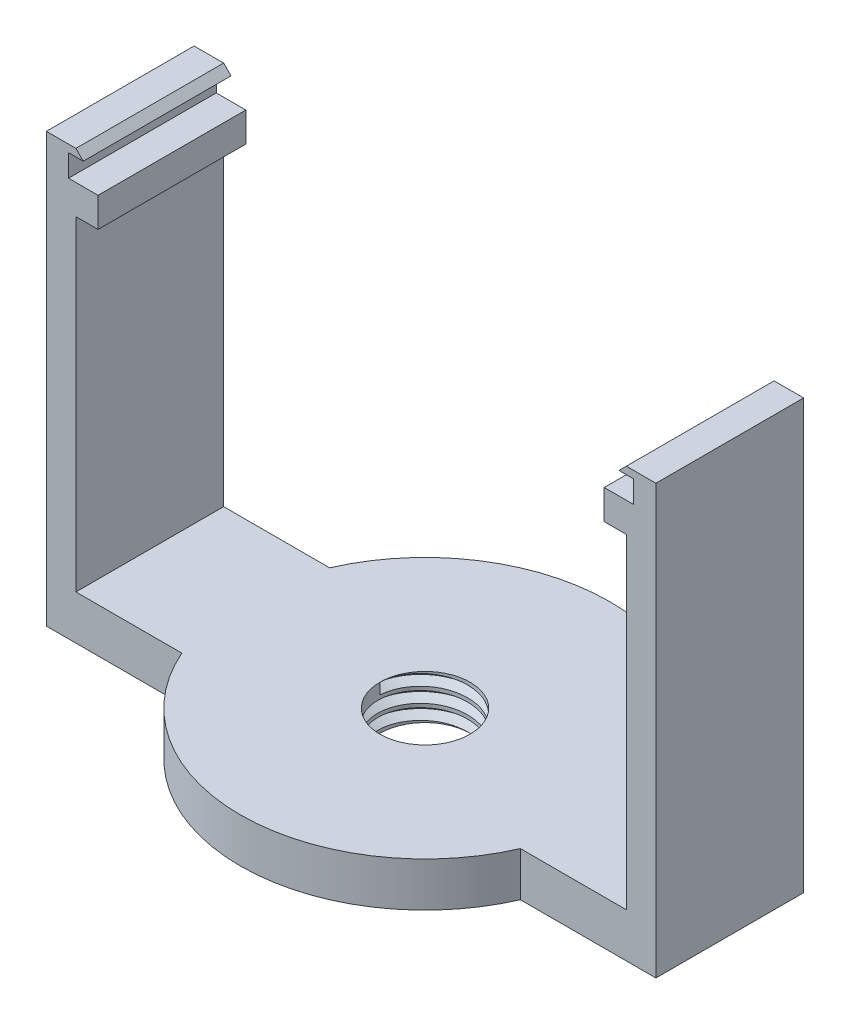
from build123d import *

# Parameters (mm, degrees)
SKETCH1_W             = 1.5
SKETCH1_H             = 10
BOSS_EXTRUDE1_DEPTH   = 4
BOSS_EXTRUDE1_2_DEPTH = 4
SKETCH3_W             = 2
SKETCH3_H             = 10
BOSS_EXTRUDE2_DEPTH   = 2
SKETCH4_W             = 2
SKETCH4_H             = 10
BOSS_EXTRUDE3_DEPTH   = 25
SKETCH5_W             = 10
SKETCH5_H             = 3
BOSS_EXTRUDE4_DEPTH   = 37.254
SKETCH6_R             = 12.5
BOSS_EXTRUDE5_DEPTH   = 3
SKETCH7_R             = 3.05
CUT_EXTRUDE1_DEPTH    = 3
THREAD1_PITCH         = 1
SKETCH8_W             = 10
SKETCH8_H             = 0.5
BOSS_EXTRUDE6_DEPTH   = 38.254
CUT_EXTRUDE2_DEPTH    = 10


with BuildPart() as part:
    # Sketch1 → Boss-Extrude1 (new body)
    with BuildSketch(Plane(origin=(0, 0, 0), x_dir=(1, 0, 0), z_dir=(0, 1, 0))):
        with Locations((7.118927, -9.469)):
            Rectangle(SKETCH1_W, SKETCH1_H)
    extrude(amount=BOSS_EXTRUDE1_DEPTH)



with BuildPart() as body_2:
    # Sketch1 → Boss-Extrude1 2 (new body)
    with BuildSketch(Plane(origin=(0, 0, 0), x_dir=(1, 0, 0), z_dir=(0, 1, 0))):
        with Locations((46.872927, -9.469)):
            Rectangle(SKETCH1_W, SKETCH1_H)
    extrude(amount=BOSS_EXTRUDE1_2_DEPTH)


with BuildPart() as part_1:
    add(part.part)

    add(body_2.part)  # Boss-Extrude2 merges body 2
    # Sketch3 → Boss-Extrude2 (add)
    with BuildSketch(Plane(origin=(0, 0, 0), x_dir=(1, 0, 0), z_dir=(0, 1, 0))):
        with Locations((8.868927, -9.469)):
            Rectangle(SKETCH3_W, SKETCH3_H)
        with Locations((45.122927, -9.469)):
            Rectangle(SKETCH3_W, SKETCH3_H)
    extrude(amount=BOSS_EXTRUDE2_DEPTH)

    # Sketch4 → Boss-Extrude3 (add)
    with BuildSketch(Plane.XZ):
        with Locations((7.368927, 9.469)):
            Rectangle(SKETCH4_W, SKETCH4_H)
        with Locations((46.622927, 9.469)):
            Rectangle(SKETCH4_W, SKETCH4_H)
    extrude(amount=BOSS_EXTRUDE3_DEPTH)

    # Sketch5 → Boss-Extrude4 (add)
    with BuildSketch(Plane(origin=(8.368927, 0, 0), x_dir=(0, 0, -1), z_dir=(1, 0, 0))):
        with Locations((-9.469, -23.5)):
            Rectangle(SKETCH5_W, SKETCH5_H)
    extrude(amount=BOSS_EXTRUDE4_DEPTH)

    # Sketch6 → Boss-Extrude5 (add)
    with BuildSketch(Plane(origin=(0, -22, 0), x_dir=(1, 0, 0), z_dir=(0, 1, 0))):
        with Locations((26.995927, -9.469)):
            Circle(SKETCH6_R)
    extrude(amount=-BOSS_EXTRUDE5_DEPTH)

    # Sketch7 → Cut-Extrude1 (cut)
    with BuildSketch(Plane(origin=(0, -22, 0), x_dir=(1, 0, 0), z_dir=(0, 1, 0))):
        with Locations(Location((26.995927, -9.469, 0), (0, 0, 270))):
            Circle(SKETCH7_R)
    extrude(amount=-CUT_EXTRUDE1_DEPTH, mode=Mode.SUBTRACT)

    # Thread1: the profile of Thread Profile1 profile screwed along a right-hand helix of 10 turns, 8 arcs to a turn; built about Z, then put on its axis
    thread1_z = Axis((0, 0, 0), (0, 0, 1))
    thread1_corners = [(3.0497, 0, -0.000173), (3.591266, 0, 0.3125), (3.591266, 0, 0.4375), (3.0497, 0, 0.750173)]
    with BuildLine(mode=Mode.PRIVATE) as thread1_profile:
        Line(thread1_corners[0], thread1_corners[1])
        Line(thread1_corners[1], thread1_corners[2])
        Line(thread1_corners[2], thread1_corners[3])
        Line(thread1_corners[3], thread1_corners[0])
    thread1_cap = Face(thread1_profile.wire())
    thread1_turn_angles = [0, 22.5, 45, 67.5, 90, 112.5, 135, 157.5, 180, 202.5, 225, 247.5, 270, 292.5, 315, 337.5, 360]
    thread1_turn_weights = [1, 0.9238795325112867, 1, 0.9238795325112867, 1, 0.9238795325112867, 1, 0.9238795325112867, 1, 0.9238795325112867, 1, 0.9238795325112867, 1, 0.9238795325112867, 1, 0.9238795325112867, 1]
    thread1_turn_rails = [Edge.make_bspline([Vector(p[0], p[1], 0).rotate(thread1_z, thread1_turn_angles[k]) / thread1_turn_weights[k] + Vector(0, 0, p[2] + THREAD1_PITCH * thread1_turn_angles[k] / 360) for k in range(17)], [0, 0, 0, 1, 1, 2, 2, 3, 3, 4, 4, 5, 5, 6, 6, 7, 7, 8, 8, 8], 2, thread1_turn_weights) for p in thread1_corners]
    thread1_turn_sides = [Face.make_surface_from_curves(thread1_turn_rails[p[0]], thread1_turn_rails[p[1]]) for p in [(0, 1), (1, 2), (2, 3), (3, 0)]]
    thread1 = Plane(origin=(26.995927, -22, 9.469), x_dir=(-1, 0, 0), z_dir=(0, -1, 0)) * Solid(Shell([*[p.moved(Location((0, 0, THREAD1_PITCH * i))) for i in range(10) for p in thread1_turn_sides], thread1_cap, thread1_cap.rotate(thread1_z, 3600).moved(Location((0, 0, THREAD1_PITCH * 3600 / 360)))]))
    add(thread1, mode=Mode.SUBTRACT)

    # Sketch8 → Boss-Extrude6 (add)
    with BuildSketch(Plane(origin=(7.868927, 0, 0), x_dir=(0, 0, -1), z_dir=(1, 0, 0))):
        with Locations((-9.469, 3.75)):
            Rectangle(SKETCH8_W, SKETCH8_H)
    extrude(amount=BOSS_EXTRUDE6_DEPTH)

    # Sketch9 → Cut-Extrude2 (cut)
    with BuildSketch(Plane.XY.offset(14.469)):
        Polygon((8.868927, 3.5), (8.368927, 4), (40.668927, 4), (45.622927, 4), (45.122927, 3.5), (40.168927, 3.5), align=None)
    extrude(amount=-CUT_EXTRUDE2_DEPTH, mode=Mode.SUBTRACT)


solid = part_1.part
